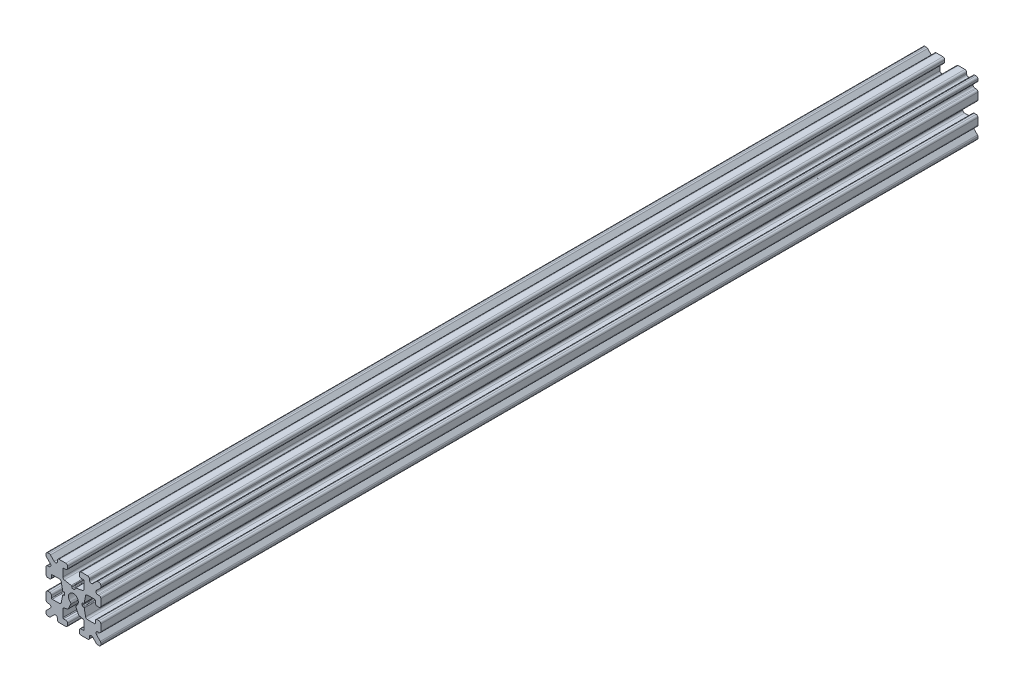
from build123d import *

# Parameters (mm, degrees)
SKETCH1_W           = 15
SKETCH1_H           = 15
SKETCH1_R           = 1.35
BOSS_EXTRUDE1_DEPTH = 120
FILLET1_R           = 0.5
CUT_EXTRUDE1_DEPTH  = 241.234260671
CUT_EXTRUDE3_DEPTH  = 241.234260671
FILLET3_R           = 0.5
FILLET4_R           = 0.5
FILLET5_R           = 3
FILLET6_R           = 0.2
CUT_EXTRUDE4_DEPTH  = 241.234260671
FILLET8_R           = 0.5
SKETCH6_W           = 6.249171159
SKETCH6_H           = 0.889
SKETCH6_W_2         = 0.889
SKETCH6_H_2         = 6.249171159
CUT_EXTRUDE5_DEPTH  = 241.234260671
CUT_EXTRUDE6_DEPTH  = 241.234260671
FILLET9_R           = 0.5
FILLET10_R          = 0.2


with BuildPart() as part:
    # Sketch1 → Boss-Extrude1 (new, symmetric)
    with BuildSketch(Plane.XY):
        Rectangle(SKETCH1_W, SKETCH1_H)
        Circle(SKETCH1_R, mode=Mode.SUBTRACT)
    extrude(amount=BOSS_EXTRUDE1_DEPTH, both=True)

    # Fillet1
    fillet1_edges = [part.edges().sort_by_distance(p)[0] for p in [
        (7.5, -7.5, 0),
        (-7.5, -7.5, 0),
        (7.5, 7.5, 0),
        (-7.5, 7.5, 0),
    ]]
    fillet(fillet1_edges, radius=FILLET1_R)

    # Sketch2 → Cut-Extrude1 (cut, through all)
    with BuildSketch(Plane.XY.offset(120)):
        Polygon((-7.5, 1.6), (-6, 1.6), (-6, 2.9), (-3.4, 2.9), (-3.4, -2.9), (-6, -2.9), (-6, -1.6), (-7.5, -1.6), align=None)
        Polygon((2.9, 6), (1.6, 6), (1.6, 7.5), (-1.6, 7.5), (-1.6, 6), (-2.9, 6), (-2.9, 3.4), (2.9, 3.4), align=None)
        Polygon((-1.6, -7.5), (-1.6, -6), (-2.9, -6), (-2.9, -3.4), (2.9, -3.4), (2.9, -6), (1.6, -6), (1.6, -7.5), align=None)
        Polygon((6, -2.9), (6, -1.6), (7.5, -1.6), (7.5, 1.6), (6, 1.6), (6, 2.9), (3.4, 2.9), (3.4, -2.9), align=None)
    extrude(amount=-CUT_EXTRUDE1_DEPTH, mode=Mode.SUBTRACT)

    # Sketch4 → Cut-Extrude3 (cut, through all)
    with BuildSketch(Plane.XY.offset(120)):
        Polygon((-3.4, 2.9), (-2.85, 0), (-3.4, -2.9), align=None)
        Polygon((-2.9, 3.4), (0, 2.85), (2.9, 3.4), align=None)
        Polygon((3.4, 2.9), (2.85, 0), (3.4, -2.9), align=None)
        Polygon((-2.9, -3.4), (0, -2.85), (2.9, -3.4), align=None)
    extrude(amount=-CUT_EXTRUDE3_DEPTH, mode=Mode.SUBTRACT)

    # Fillet3
    fillet3_edges = [part.edges().sort_by_distance(p)[0] for p in [
        (-6, -1.6, 0),
        (-7.5, -1.6, 0),
        (-6, 1.6, 0),
        (-7.5, 1.6, 0),
        (-1.6, -7.5, 0),
        (-1.6, -6, 0),
        (1.6, -7.5, 0),
        (1.6, -6, 0),
        (6, -1.6, 0),
        (7.5, -1.6, 0),
        (7.5, 1.6, 0),
        (6, 1.6, 0),
        (1.6, 7.5, 0),
        (1.6, 6, 0),
        (-1.6, 7.5, 0),
        (-1.6, 6, 0),
    ]]
    fillet(fillet3_edges, radius=FILLET3_R)

    # Fillet4
    fillet4_edges = [part.edges().sort_by_distance(p)[0] for p in [
        (-3.4, 2.9, 0),
        (-3.4, -2.9, 0),
        (2.9, -3.4, 0),
        (-2.9, -3.4, 0),
        (3.4, -2.9, 0),
        (3.4, 2.9, 0),
        (-2.9, 3.4, 0),
        (2.9, 3.4, 0),
    ]]
    fillet(fillet4_edges, radius=FILLET4_R)

    # Fillet5
    fillet5_edges = [part.edges().sort_by_distance(p)[0] for p in [
        (0, -2.85, 0),
        (2.85, 0, 0),
        (-2.85, 0, 0),
        (0, 2.85, 0),
    ]]
    fillet(fillet5_edges, radius=FILLET5_R)

    # Fillet6
    fillet6_edges = [part.edges().sort_by_distance(p)[0] for p in [
        (-2.9, -6, 0),
        (2.9, -6, 0),
        (6, -2.9, 0),
        (6, 2.9, 0),
        (2.9, 6, 0),
        (-2.9, 6, 0),
        (-6, -2.9, 0),
        (-6, 2.9, 0),
    ]]
    fillet(fillet6_edges, radius=FILLET6_R)

    # Sketch5 → Cut-Extrude4 (cut, through all)
    with BuildSketch(Plane.XY.offset(120)):
        Polygon((-7.5, 6.439339828), (-5.460660172, 4.4), (-7.5, 4.4), align=None)
        Polygon((-6.439339828, 7.5), (-4.4, 5.460660172), (-4.4, 7.5), align=None)
        Polygon((4.4, 7.5), (6.439339828, 7.5), (4.4, 5.460660172), align=None)
        Polygon((7.5, 6.439339828), (7.5, 4.4), (5.460660172, 4.4), align=None)
        Polygon((7.5, -6.439339828), (5.460660172, -4.4), (7.5, -4.4), align=None)
        Polygon((6.439339828, -7.5), (4.4, -5.460660172), (4.4, -7.5), align=None)
        Polygon((-4.4, -7.5), (-6.439339828, -7.5), (-4.4, -5.460660172), align=None)
        Polygon((-7.5, -6.439339828), (-7.5, -4.4), (-5.460660172, -4.4), align=None)
    extrude(amount=-CUT_EXTRUDE4_DEPTH, mode=Mode.SUBTRACT)

    # Fillet8
    fillet8_edges = [part.edges().sort_by_distance(p)[0] for p in [
        (-5.460660172, 4.4, 0),
        (-7.5, 4.4, 0),
        (-5.460660172, -4.4, 0),
        (-7.5, -4.4, 0),
        (-4.4, -7.5, 0),
        (-4.4, -5.460660172, 0),
        (4.4, -7.5, 0),
        (4.4, -5.460660172, 0),
        (5.460660172, -4.4, 0),
        (7.5, -4.4, 0),
        (7.5, 4.4, 0),
        (5.460660172, 4.4, 0),
        (4.4, 5.460660172, 0),
        (4.4, 7.5, 0),
        (-4.4, 5.460660172, 0),
        (-4.4, 7.5, 0),
        (-6.439339828, 7.5, 0),
        (-7.5, 6.439339828, 0),
        (6.439339828, 7.5, 0),
        (7.5, 6.439339828, 0),
        (6.439339828, -7.5, 0),
        (7.5, -6.439339828, 0),
        (-6.439339828, -7.5, 0),
        (-7.5, -6.439339828, 0),
    ]]
    fillet(fillet8_edges, radius=FILLET8_R)

    # Sketch6 → Cut-Extrude5 (cut, through all)
    with BuildSketch(Plane.XY.offset(120)):
        with Locations((5.530603002, 0)):
            Rectangle(SKETCH6_W, SKETCH6_H)
        with Locations((-5.530603002, 0)):
            Rectangle(SKETCH6_W, SKETCH6_H)
        with Locations((0, 5.530603002)):
            Rectangle(SKETCH6_W_2, SKETCH6_H_2)
    extrude(amount=-CUT_EXTRUDE5_DEPTH, mode=Mode.SUBTRACT)

    # Sketch7 → Cut-Extrude6 (cut, through all)
    with BuildSketch(Plane.XY.offset(120)):
        Polygon((0, 0), (-2.153335353, -4.617842566), (2.153335353, -4.617842566), align=None)
    extrude(amount=-CUT_EXTRUDE6_DEPTH, mode=Mode.SUBTRACT)

    # Fillet9
    fillet9_edges = [part.edges().sort_by_distance(p)[0] for p in [
        (0.570534653, -1.223515512, 0),
        (-0.570534653, -1.223515512, 0),
        (1.457911068, -3.126500375, 0),
        (-1.457911068, -3.126500375, 0),
    ]]
    fillet(fillet9_edges, radius=FILLET9_R)

    # Fillet10
    fillet10_edges = [part.edges().sort_by_distance(p)[0] for p in [
        (-2.406017422, 0.4445, 0),
        (-2.406017422, -0.4445, 0),
        (0.4445, 2.406017422, 0),
        (-0.4445, 2.406017422, 0),
        (2.406017422, 0.4445, 0),
        (2.406017422, -0.4445, 0),
        (-2.93658978, -0.4445, 0),
        (-2.93658978, 0.4445, 0),
        (2.93658978, -0.4445, 0),
        (2.93658978, 0.4445, 0),
        (0.4445, 2.93658978, 0),
        (-0.4445, 2.93658978, 0),
    ]]
    fillet(fillet10_edges, radius=FILLET10_R)


solid = part.part
